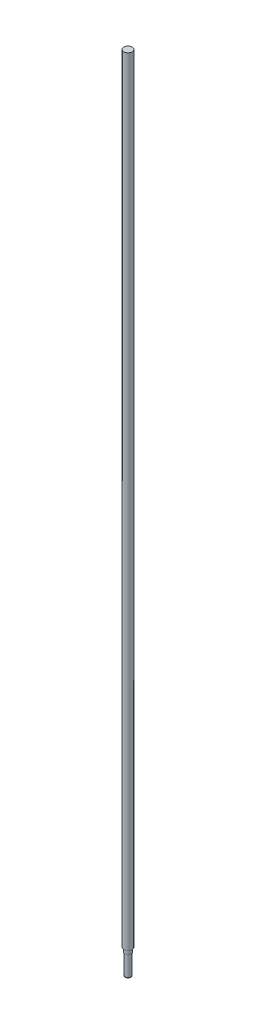
from build123d import *

# Parameters (mm, degrees)
SKETCH_1_R          = 50
EXTRUDE_1_DEPTH     = 9600
SKETCH_3_R          = 50
SKETCH_3_R_2        = 40
CUT_EXTRUDE_1_DEPTH = 9301.268813319
SKETCH_4_R          = 40
SKETCH_4_R_2        = 35
CUT_EXTRUDE_2_DEPTH = 9351.267375856
FILLET_1_R          = 10


with BuildPart() as part:
    # ｽｹｯﾁ1 → ﾎﾞｽ - 押し出し1 (new body)
    with BuildSketch(Plane(origin=(0, 0, 0), x_dir=(1, 0, 0), z_dir=(0, 1, 0))):
        Circle(SKETCH_1_R)
    extrude(amount=EXTRUDE_1_DEPTH)

    # ｽｹｯﾁ3 → ｶｯﾄ - 押し出し1 (cut, through all)
    with BuildSketch(Plane(origin=(0, 300, 0), x_dir=(1, 0, 0), z_dir=(0, 1, 0))):
        Circle(SKETCH_3_R)
        Circle(SKETCH_3_R_2, mode=Mode.SUBTRACT)
    extrude(amount=-CUT_EXTRUDE_1_DEPTH, mode=Mode.SUBTRACT)

    # ｽｹｯﾁ4 → ｶｯﾄ - 押し出し2 (cut, through all)
    with BuildSketch(Plane(origin=(0, 250, 0), x_dir=(1, 0, 0), z_dir=(0, 1, 0))):
        Circle(SKETCH_4_R)
        Circle(SKETCH_4_R_2, mode=Mode.SUBTRACT)
    extrude(amount=-CUT_EXTRUDE_2_DEPTH, mode=Mode.SUBTRACT)

    # ﾌｨﾚｯﾄ1
    fillet_1_edges = [part.edges().sort_by_distance(p)[0] for p in [
        (-35, 0, 0),
    ]]
    fillet(fillet_1_edges, radius=FILLET_1_R)


solid = part.part
